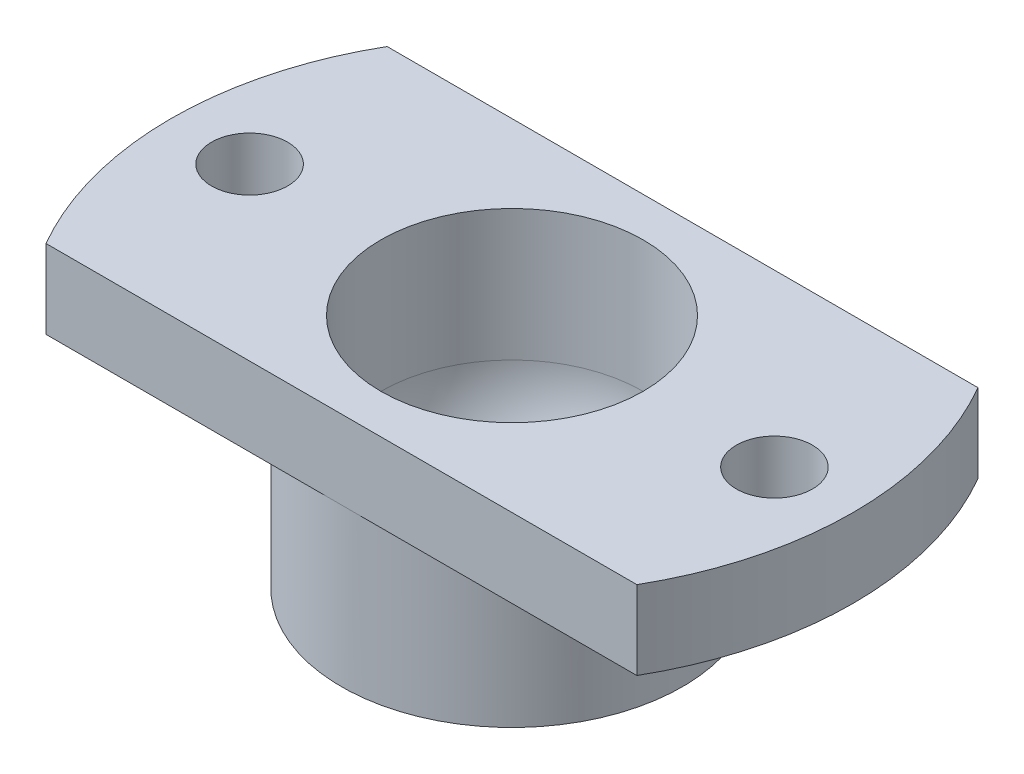
from build123d import *

# Parameters (mm, degrees)
CIRPATTERN2_COUNT  = 2
SKETCH5_W          = 50.426982916
SKETCH5_H          = 33.50460585
SKETCH5_W_2        = 37.991098709
SKETCH5_H_2        = 13
CUT_EXTRUDE1_DEPTH = 20.339079606


with BuildPart() as part:
    # Sketch1 → Revolve1 (revolve)
    with BuildSketch(Plane(origin=(0, 0, 0), x_dir=(0, 0, -1), z_dir=(1, 0, 0))):
        with BuildLine():
            Line((-13, 5), (-5, 5))
            Line((-5, 5), (-5, 0))
            ThreePointArc((-5, 0), (-4.472135955, -2.236067977), (-3, -4))
            Line((-3, -4), (-6.5, -4))
            Line((-6.5, -4), (-6.5, 2))
            Line((-6.5, 2), (-13, 2))
            Line((-13, 2), (-13, 5))
        make_face()
    revolve(axis=Axis((0, 0, 0), (0, 1, 0)))

    # Sketch3 → M2.5 Clearance Hole1 (revolve, cut)
    with BuildSketch(Plane(origin=(-10, 2, 0), x_dir=(0, 0, -1), z_dir=(1, 0, 0))):
        Polygon((0, 0), (0, 10.871247898), (1.45, 10), (1.45, 0), align=None)
    m2_5_clearance_hole1 = revolve(axis=Axis((-10, -4.35, 0), (0, 1, 0)), mode=Mode.SUBTRACT)

    # CirPattern2: M2.5 Clearance Hole1 ×2 about axis
    cirpattern2_axis = Axis((0, 0, 0), (0, 1, 0))
    for i in range(1, CIRPATTERN2_COUNT):
        add(m2_5_clearance_hole1.rotate(cirpattern2_axis, i * 360 / CIRPATTERN2_COUNT), mode=Mode.SUBTRACT)

    # Sketch5 → Cut-Extrude1 (cut, through all)
    with BuildSketch(Plane.XZ.offset(-2)):
        with Locations((1.488148737, 1.020444848)):
            Rectangle(SKETCH5_W, SKETCH5_H)
        with Locations((1.919239442, 0)):
            Rectangle(SKETCH5_W_2, SKETCH5_H_2, mode=Mode.SUBTRACT)
    extrude(amount=-CUT_EXTRUDE1_DEPTH, mode=Mode.SUBTRACT)


solid = part.part
